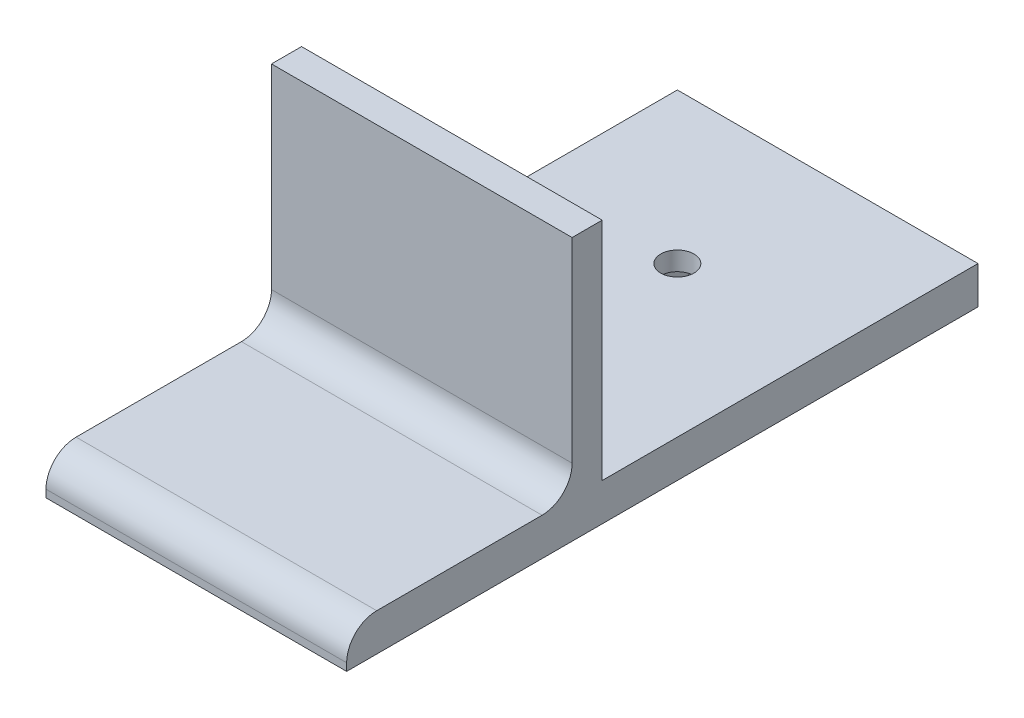
from build123d import *

# Parameters (mm, degrees)
BOSS_EXTRUDE1_DEPTH    = 50.8
F_10_CLEARANCE_HOLE1_D = 5.6134
CUT_EXTRUDE1_DEPTH     = 3.175
FILLET1_R              = 5.08


with BuildPart() as part:
    # Sketch1 → Boss-Extrude1 (new body)
    with BuildSketch(Plane(origin=(0, 0, 0), x_dir=(0, 0, -1), z_dir=(1, 0, 0))):
        Polygon((0, 0), (106.68, 0), (106.68, 6.35), (43.18, 6.35), (43.18, 44.45), (38.1, 44.45), (38.1, 6.35), (0, 6.35), align=None)
    extrude(amount=BOSS_EXTRUDE1_DEPTH)

    # #10 Clearance Hole1 (through all)
    with Locations(Plane(origin=(0, 6.35, 0), x_dir=(1, 0, 0), z_dir=(0, 1, 0))):
        with Locations((25.4, 81.28)):
            Hole(F_10_CLEARANCE_HOLE1_D / 2)

    # Sketch8 → Cut-Extrude1 (cut)
    with BuildSketch(Plane.XZ):
        Polygon((28.079192668, -85.818297991), (30.669877684, -81.228900084), (27.990685016, -76.690602093), (22.720807332, -76.741702009), (20.130122316, -81.331099916), (22.809314984, -85.869397907), align=None)
    extrude(amount=-CUT_EXTRUDE1_DEPTH, mode=Mode.SUBTRACT)

    # Fillet1
    fillet1_edges = [part.edges().sort_by_distance(p)[0] for p in [
        (25.4, 6.35, 0),
        (25.4, 6.35, -38.1),
    ]]
    fillet(fillet1_edges, radius=FILLET1_R)


solid = part.part
